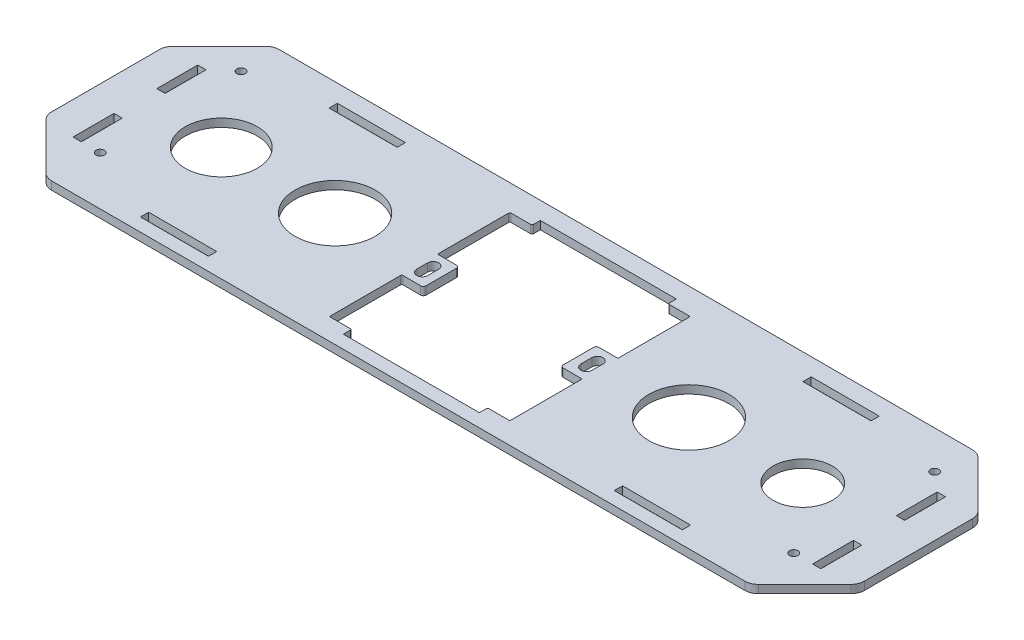
from build123d import *

# Parameters (mm, degrees)
BASE_FLANGE1_START = -3
BASE_FLANGE1_DEPTH = 3
SKETCH6_R          = 1.55
CUT_EXTRUDE1_DEPTH = 10
SKETCH7_R          = 1.55
CUT_EXTRUDE2_DEPTH = 10
SKETCH9_R          = 14.8
SKETCH9_R_2        = 13.3
SKETCH9_R_3        = 10.95
CUT_EXTRUDE4_DEPTH = 10
SKETCH8_W          = 50.2
SKETCH8_H          = 3.05
SKETCH8_W_2        = 25.1
SKETCH8_W_3        = 3.05
SKETCH8_H_2        = 15.1
CUT_EXTRUDE5_DEPTH = 10
FILLET2_R          = 0.5


# Read off the part's stored shape, not the designer's step: Base-Flange1
with BuildPart() as part:
    # Base-Flange1 outline → Base-Flange1 (new body)
    with BuildSketch(Plane(origin=(0, 0, 0), x_dir=(1, 0, 0), z_dir=(0, 1, 0)).offset(BASE_FLANGE1_START)):
        with BuildLine():
            Line((-127.928932188, 76), (127.928932188, 76))
            ThreePointArc((127.928932188, 76), (129.84234935, 76.380602337), (131.464466094, 77.464466094))
            Line((131.464466094, 77.464466094), (148.535533906, 94.535533906))
            ThreePointArc((148.535533906, 94.535533906), (149.619397663, 96.15765065), (150, 98.071067812))
            Line((150, 98.071067812), (150, 137.928932188))
            ThreePointArc((150, 137.928932188), (149.619397663, 139.84234935), (148.535533906, 141.464466094))
            Line((148.535533906, 141.464466094), (131.464466094, 158.535533906))
            ThreePointArc((131.464466094, 158.535533906), (129.84234935, 159.619397663), (127.928932188, 160))
            Line((127.928932188, 160), (-127.928932188, 160))
            ThreePointArc((-127.928932188, 160), (-129.84234935, 159.619397663), (-131.464466094, 158.535533906))
            Line((-131.464466094, 158.535533906), (-148.535533906, 141.464466094))
            ThreePointArc((-148.535533906, 141.464466094), (-149.619397663, 139.84234935), (-150, 137.928932188))
            Line((-150, 137.928932188), (-150, 98.071067812))
            ThreePointArc((-150, 98.071067812), (-149.619397663, 96.15765065), (-148.535533906, 94.535533906))
            Line((-148.535533906, 94.535533906), (-131.464466094, 77.464466094))
            ThreePointArc((-131.464466094, 77.464466094), (-129.84234935, 76.380602337), (-127.928932188, 76))
        make_face()
    extrude(amount=BASE_FLANGE1_DEPTH)

    # Sketch6 → Cut-Extrude1 (cut)
    with BuildSketch(Plane(origin=(0, 0, 0), x_dir=(1, 0, 0), z_dir=(0, 1, 0))):
        with Locations(Location((128, 146, 0), (0, 0, 270))):
            Circle(SKETCH6_R)
        with Locations(Location((-128, 146, 0), (0, 0, 90))):
            Circle(SKETCH6_R)
    extrude(amount=-CUT_EXTRUDE1_DEPTH, mode=Mode.SUBTRACT)

    # Sketch7 → Cut-Extrude2 (cut)
    with BuildSketch(Plane(origin=(0, 0, 0), x_dir=(1, 0, 0), z_dir=(0, 1, 0))):
        with Locations(Location((-128, 94, 0), (0, 0, 270))):
            Circle(SKETCH7_R)
        with Locations(Location((128, 94, 0), (0, 0, 90))):
            Circle(SKETCH7_R)
    extrude(amount=-CUT_EXTRUDE2_DEPTH, mode=Mode.SUBTRACT)

    # Sketch9 → Cut-Extrude4 (cut)
    with BuildSketch(Plane(origin=(0, 0, 0), x_dir=(1, 0, 0), z_dir=(0, 1, 0))):
        with Locations(Location((-65.3, 118, 0), (0, 0, 270))):
            Circle(SKETCH9_R)
        with Locations(Location((65.3, 118, 0), (0, 0, 270))):
            Circle(SKETCH9_R)
        with Locations(Location((-107.3, 118, 0), (0, 0, 270))):
            Circle(SKETCH9_R_2)
        with Locations(Location((107.3, 118, 0), (0, 0, 270))):
            Circle(SKETCH9_R_3)
        with BuildLine():
            Line((-32.9, 83.9), (32.9, 83.9))
            ThreePointArc((32.9, 83.9), (33.182842712, 84.017157288), (33.3, 84.3))
            Line((33.3, 84.3), (33.3, 110.2))
            ThreePointArc((33.3, 110.2), (33.182842712, 110.482842712), (32.9, 110.6))
            Line((32.9, 110.6), (26.3, 110.6))
            ThreePointArc((26.3, 110.6), (25.592893219, 110.892893219), (25.3, 111.6))
            Line((25.3, 111.6), (25.3, 122.8))
            ThreePointArc((25.3, 122.8), (25.592893219, 123.507106781), (26.3, 123.8))
            Line((26.3, 123.8), (32.9, 123.8))
            ThreePointArc((32.9, 123.8), (33.182842712, 123.917157288), (33.3, 124.2))
            Line((33.3, 124.2), (33.3, 150.1))
            ThreePointArc((33.3, 150.1), (33.182842712, 150.382842712), (32.9, 150.5))
            Line((32.9, 150.5), (-32.9, 150.5))
            ThreePointArc((-32.9, 150.5), (-33.182842712, 150.382842712), (-33.3, 150.1))
            Line((-33.3, 150.1), (-33.3, 124.2))
            ThreePointArc((-33.3, 124.2), (-33.182842712, 123.917157288), (-32.9, 123.8))
            Line((-32.9, 123.8), (-26.3, 123.8))
            ThreePointArc((-26.3, 123.8), (-25.592893219, 123.507106781), (-25.3, 122.8))
            Line((-25.3, 122.8), (-25.3, 111.6))
            ThreePointArc((-25.3, 111.6), (-25.592893219, 110.892893219), (-26.3, 110.6))
            Line((-26.3, 110.6), (-32.9, 110.6))
            ThreePointArc((-32.9, 110.6), (-33.182842712, 110.482842712), (-33.3, 110.2))
            Line((-33.3, 110.2), (-33.3, 84.3))
            ThreePointArc((-33.3, 84.3), (-33.182842712, 84.017157288), (-32.9, 83.9))
        make_face()
        with BuildLine():
            Line((-28.25, 119.2), (-28.25, 115.2))
            ThreePointArc((-28.25, 115.2), (-30.3, 113.15), (-32.35, 115.2))
            Line((-32.35, 115.2), (-32.35, 119.2))
            ThreePointArc((-32.35, 119.2), (-30.3, 121.25), (-28.25, 119.2))
        make_face()
        with BuildLine():
            Line((28.25, 119.2), (28.25, 115.2))
            ThreePointArc((28.25, 115.2), (30.3, 113.15), (32.35, 115.2))
            Line((32.35, 115.2), (32.35, 119.2))
            ThreePointArc((32.35, 119.2), (30.3, 121.25), (28.25, 119.2))
        make_face()
    extrude(amount=-CUT_EXTRUDE4_DEPTH, mode=Mode.SUBTRACT)

    # Sketch8 → Cut-Extrude5 (cut)
    with BuildSketch(Plane(origin=(0, 0, 0), x_dir=(1, 0, 0), z_dir=(0, 1, 0))):
        with Locations((0, 82.375)):
            Rectangle(SKETCH8_W, SKETCH8_H)
        with Locations((87.45, 82.375)):
            Rectangle(SKETCH8_W_2, SKETCH8_H)
        with Locations((136.475, 132.45)):
            Rectangle(SKETCH8_W_3, SKETCH8_H_2)
        with Locations((0, 152.025)):
            Rectangle(SKETCH8_W, SKETCH8_H)
        with Locations((87.45, 152.025)):
            Rectangle(SKETCH8_W_2, SKETCH8_H)
        with Locations((-87.45, 152.025)):
            Rectangle(SKETCH8_W_2, SKETCH8_H)
        with Locations((136.475, 101.55)):
            Rectangle(SKETCH8_W_3, SKETCH8_H_2)
        with Locations((-87.45, 82.375)):
            Rectangle(SKETCH8_W_2, SKETCH8_H)
        with Locations((-136.475, 101.55)):
            Rectangle(SKETCH8_W_3, SKETCH8_H_2)
        with Locations((-136.475, 132.45)):
            Rectangle(SKETCH8_W_3, SKETCH8_H_2)
    extrude(amount=-CUT_EXTRUDE5_DEPTH, mode=Mode.SUBTRACT)

    # Fillet2
    fillet2_edges = [part.edges().sort_by_distance(p)[0] for p in [
        (-25.1, -1.5, -150.5),
        (25.1, -1.5, -150.5),
        (-25.1, -1.5, -83.9),
        (25.1, -1.5, -83.9),
    ]]
    fillet(fillet2_edges, radius=FILLET2_R)


solid = part.part
